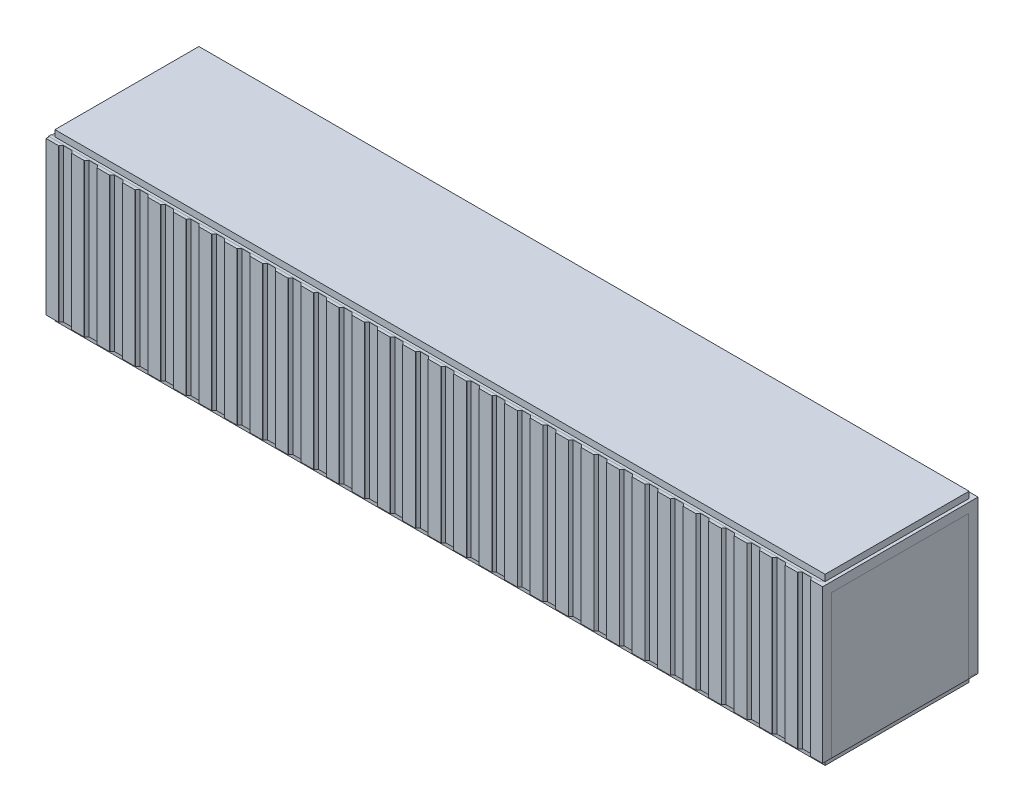
from build123d import *

# Parameters (mm, degrees)
EXTRUDE_THIN1_DEPTH      = 2400
BOSS_EXTRUDE1_DEPTH      = 10
SKETCH2_W                = 12090
SKETCH2_H                = 2260
BOSS_EXTRUDE2_DEPTH      = 100
SKETCH3_W                = 12090
SKETCH3_H                = 2340
BOSS_EXTRUDE3_DEPTH      = 10
SKETCH4_W                = 12090
SKETCH4_H                = 2260
BOSS_EXTRUDE4_DEPTH      = 100
CUT_EXTRUDE1_DEPTH       = 500
CUT_EXTRUDE1_DEPTH_BACK  = 50000
SKETCH5_W                = 2150
SKETCH5_H                = 2250
SKETCH6_W                = 2150
SKETCH6_H                = 2250
BOSS_EXTRUDE5_DEPTH      = 30
SKETCH7_W                = 2150
SKETCH7_H                = 2250
BOSS_EXTRUDE6_DEPTH      = 30
SKETCH8_W                = 12190
SKETCH8_H                = 2347.971493335
BOSS_EXTRUDE7_DEPTH      = 20
BOSS_EXTRUDE8_DEPTH      = 5
BOSS_EXTRUDE8_DEPTH_BACK = 40
SKETCH9_W                = 12160
SKETCH9_H                = 2300
BOSS_EXTRUDE9_DEPTH      = 5
BOSS_EXTRUDE9_DEPTH_BACK = 40
SKETCH10_W               = 12170
SKETCH10_H               = 2390


# Read off the part's stored shape, not the designer's step: Extrude-Thin1
with BuildPart() as part:
    # Extrude-Thin1 outline → Extrude-Thin1 (new body)
    with BuildSketch(Plane(origin=(0, 0, 0), x_dir=(1, 0, 0), z_dir=(0, 1, 0))):
        Polygon((0, 2440), (0, 0), (200, 0), (200, 5), (235, 40), (365, 40), (400, 5), (400, 0), (600, 0), (600, 5), (635, 40), (765, 40), (800, 5), (800, 0), (1000, 0), (1000, 5), (1035, 40), (1165, 40), (1200, 5), (1200, 0), (1400, 0), (1400, 5), (1435, 40), (1565, 40), (1600, 5), (1600, 0), (1800, 0), (1800, 5), (1835, 40), (1965, 40), (2000, 5), (2000, 0), (2200, 0), (2200, 5), (2235, 40), (2365, 40), (2400, 5), (2400, 0), (2600, 0), (2600, 5), (2635, 40), (2765, 40), (2800, 5), (2800, 0), (3000, 0), (3000, 5), (3035, 40), (3165, 40), (3200, 5), (3200, 0), (3400, 0), (3400, 5), (3435, 40), (3565, 40), (3600, 5), (3600, 0), (3800, 0), (3800, 5), (3835, 40), (3965, 40), (4000, 5), (4000, 0), (4200, 0), (4200, 5), (4235, 40), (4365, 40), (4400, 5), (4400, 0), (4600, 0), (4600, 5), (4635, 40), (4765, 40), (4800, 5), (4800, 0), (5000, 0), (5000, 5), (5035, 40), (5165, 40), (5200, 5), (5200, 0), (5400, 0), (5400, 5), (5435, 40), (5565, 40), (5600, 5), (5600, 0), (5800, 0), (5800, 5), (5835, 40), (5965, 40), (6000, 5), (6000, 0), (6200, 0), (6200, 5), (6235, 40), (6365, 40), (6400, 5), (6400, 0), (6600, 0), (6600, 5), (6635, 40), (6765, 40), (6800, 5), (6800, 0), (7000, 0), (7000, 5), (7035, 40), (7165, 40), (7200, 5), (7200, 0), (7400, 0), (7400, 5), (7435, 40), (7565, 40), (7600, 5), (7600, 0), (7800, 0), (7800, 5), (7835, 40), (7965, 40), (8000, 5), (8000, 0), (8200, 0), (8200, 5), (8235, 40), (8365, 40), (8400, 5), (8400, 0), (8600, 0), (8600, 5), (8635, 40), (8765, 40), (8800, 5), (8800, 0), (9000, 0), (9000, 5), (9035, 40), (9165, 40), (9200, 5), (9200, 0), (9400, 0), (9400, 5), (9435, 40), (9565, 40), (9600, 5), (9600, 0), (9800, 0), (9800, 5), (9835, 40), (9965, 40), (10000, 5), (10000, 0), (10200, 0), (10200, 5), (10235, 40), (10365, 40), (10400, 5), (10400, 0), (10600, 0), (10600, 5), (10635, 40), (10765, 40), (10800, 5), (10800, 0), (11000, 0), (11000, 5), (11035, 40), (11165, 40), (11200, 5), (11200, 0), (11400, 0), (11400, 5), (11435, 40), (11565, 40), (11600, 5), (11600, 0), (11800, 0), (11800, 5), (11835, 40), (11965, 40), (12000, 5), (12000, 0), (12190, 0), (12190, 2440), (12000, 2440), (12000, 2435), (11965, 2400), (11835, 2400), (11800, 2435), (11800, 2440), (11600, 2440), (11600, 2435), (11565, 2400), (11435, 2400), (11400, 2435), (11400, 2440), (11200, 2440), (11200, 2435), (11165, 2400), (11035, 2400), (11000, 2435), (11000, 2440), (10800, 2440), (10800, 2435), (10765, 2400), (10635, 2400), (10600, 2435), (10600, 2440), (10400, 2440), (10400, 2435), (10365, 2400), (10235, 2400), (10200, 2435), (10200, 2440), (10000, 2440), (10000, 2435), (9965, 2400), (9835, 2400), (9800, 2435), (9800, 2440), (9600, 2440), (9600, 2435), (9565, 2400), (9435, 2400), (9400, 2435), (9400, 2440), (9200, 2440), (9200, 2435), (9165, 2400), (9035, 2400), (9000, 2435), (9000, 2440), (8800, 2440), (8800, 2435), (8765, 2400), (8635, 2400), (8600, 2435), (8600, 2440), (8400, 2440), (8400, 2435), (8365, 2400), (8235, 2400), (8200, 2435), (8200, 2440), (8000, 2440), (8000, 2435), (7965, 2400), (7835, 2400), (7800, 2435), (7800, 2440), (7600, 2440), (7600, 2435), (7565, 2400), (7435, 2400), (7400, 2435), (7400, 2440), (7200, 2440), (7200, 2435), (7165, 2400), (7035, 2400), (7000, 2435), (7000, 2440), (6800, 2440), (6800, 2435), (6765, 2400), (6635, 2400), (6600, 2435), (6600, 2440), (6400, 2440), (6400, 2435), (6365, 2400), (6235, 2400), (6200, 2435), (6200, 2440), (6000, 2440), (6000, 2435), (5965, 2400), (5835, 2400), (5800, 2435), (5800, 2440), (5600, 2440), (5600, 2435), (5565, 2400), (5435, 2400), (5400, 2435), (5400, 2440), (5200, 2440), (5200, 2435), (5165, 2400), (5035, 2400), (5000, 2435), (5000, 2440), (4800, 2440), (4800, 2435), (4765, 2400), (4635, 2400), (4600, 2435), (4600, 2440), (4400, 2440), (4400, 2435), (4365, 2400), (4235, 2400), (4200, 2435), (4200, 2440), (4000, 2440), (4000, 2435), (3965, 2400), (3835, 2400), (3800, 2435), (3800, 2440), (3600, 2440), (3600, 2435), (3565, 2400), (3435, 2400), (3400, 2435), (3400, 2440), (3200, 2440), (3200, 2435), (3165, 2400), (3035, 2400), (3000, 2435), (3000, 2440), (2800, 2440), (2800, 2435), (2765, 2400), (2635, 2400), (2600, 2435), (2600, 2440), (2400, 2440), (2400, 2435), (2365, 2400), (2235, 2400), (2200, 2435), (2200, 2440), (2000, 2440), (2000, 2435), (1965, 2400), (1835, 2400), (1800, 2435), (1800, 2440), (1600, 2440), (1600, 2435), (1565, 2400), (1435, 2400), (1400, 2435), (1400, 2440), (1200, 2440), (1200, 2435), (1165, 2400), (1035, 2400), (1000, 2435), (1000, 2440), (800, 2440), (800, 2435), (765, 2400), (635, 2400), (600, 2435), (600, 2440), (400, 2440), (400, 2435), (365, 2400), (235, 2400), (200, 2435), (200, 2440), align=None)
        Polygon((174.289321881, 50), (50, 50), (50, 2390), (174.289321881, 2390), (214.289321881, 2350), (385.710678119, 2350), (425.710678119, 2390), (574.289321881, 2390), (614.289321881, 2350), (785.710678119, 2350), (825.710678119, 2390), (974.289321881, 2390), (1014.289321881, 2350), (1185.710678119, 2350), (1225.710678119, 2390), (1374.289321881, 2390), (1414.289321881, 2350), (1585.710678119, 2350), (1625.710678119, 2390), (1774.289321881, 2390), (1814.289321881, 2350), (1985.710678119, 2350), (2025.710678119, 2390), (2174.289321881, 2390), (2214.289321881, 2350), (2385.710678119, 2350), (2425.710678119, 2390), (2574.289321881, 2390), (2614.289321881, 2350), (2785.710678119, 2350), (2825.710678119, 2390), (2974.289321881, 2390), (3014.289321881, 2350), (3185.710678119, 2350), (3225.710678119, 2390), (3374.289321881, 2390), (3414.289321881, 2350), (3585.710678119, 2350), (3625.710678119, 2390), (3774.289321881, 2390), (3814.289321881, 2350), (3985.710678119, 2350), (4025.710678119, 2390), (4174.289321881, 2390), (4214.289321881, 2350), (4385.710678119, 2350), (4425.710678119, 2390), (4574.289321881, 2390), (4614.289321881, 2350), (4785.710678119, 2350), (4825.710678119, 2390), (4974.289321881, 2390), (5014.289321881, 2350), (5185.710678119, 2350), (5225.710678119, 2390), (5374.289321881, 2390), (5414.289321881, 2350), (5585.710678119, 2350), (5625.710678119, 2390), (5774.289321881, 2390), (5814.289321881, 2350), (5985.710678119, 2350), (6025.710678119, 2390), (6174.289321881, 2390), (6214.289321881, 2350), (6385.710678119, 2350), (6425.710678119, 2390), (6574.289321881, 2390), (6614.289321881, 2350), (6785.710678119, 2350), (6825.710678119, 2390), (6974.289321881, 2390), (7014.289321881, 2350), (7185.710678119, 2350), (7225.710678119, 2390), (7374.289321881, 2390), (7414.289321881, 2350), (7585.710678119, 2350), (7625.710678119, 2390), (7774.289321881, 2390), (7814.289321881, 2350), (7985.710678119, 2350), (8025.710678119, 2390), (8174.289321881, 2390), (8214.289321881, 2350), (8385.710678119, 2350), (8425.710678119, 2390), (8574.289321881, 2390), (8614.289321881, 2350), (8785.710678119, 2350), (8825.710678119, 2390), (8974.289321881, 2390), (9014.289321881, 2350), (9185.710678119, 2350), (9225.710678119, 2390), (9374.289321881, 2390), (9414.289321881, 2350), (9585.710678119, 2350), (9625.710678119, 2390), (9774.289321881, 2390), (9814.289321881, 2350), (9985.710678119, 2350), (10025.710678119, 2390), (10174.289321881, 2390), (10214.289321881, 2350), (10385.710678119, 2350), (10425.710678119, 2390), (10574.289321881, 2390), (10614.289321881, 2350), (10785.710678119, 2350), (10825.710678119, 2390), (10974.289321881, 2390), (11014.289321881, 2350), (11185.710678119, 2350), (11225.710678119, 2390), (11374.289321881, 2390), (11414.289321881, 2350), (11585.710678119, 2350), (11625.710678119, 2390), (11774.289321881, 2390), (11814.289321881, 2350), (11985.710678119, 2350), (12025.710678119, 2390), (12140, 2390), (12140, 50), (12025.710678119, 50), (11985.710678119, 90), (11814.289321881, 90), (11774.289321881, 50), (11625.710678119, 50), (11585.710678119, 90), (11414.289321881, 90), (11374.289321881, 50), (11225.710678119, 50), (11185.710678119, 90), (11014.289321881, 90), (10974.289321881, 50), (10825.710678119, 50), (10785.710678119, 90), (10614.289321881, 90), (10574.289321881, 50), (10425.710678119, 50), (10385.710678119, 90), (10214.289321881, 90), (10174.289321881, 50), (10025.710678119, 50), (9985.710678119, 90), (9814.289321881, 90), (9774.289321881, 50), (9625.710678119, 50), (9585.710678119, 90), (9414.289321881, 90), (9374.289321881, 50), (9225.710678119, 50), (9185.710678119, 90), (9014.289321881, 90), (8974.289321881, 50), (8825.710678119, 50), (8785.710678119, 90), (8614.289321881, 90), (8574.289321881, 50), (8425.710678119, 50), (8385.710678119, 90), (8214.289321881, 90), (8174.289321881, 50), (8025.710678119, 50), (7985.710678119, 90), (7814.289321881, 90), (7774.289321881, 50), (7625.710678119, 50), (7585.710678119, 90), (7414.289321881, 90), (7374.289321881, 50), (7225.710678119, 50), (7185.710678119, 90), (7014.289321881, 90), (6974.289321881, 50), (6825.710678119, 50), (6785.710678119, 90), (6614.289321881, 90), (6574.289321881, 50), (6425.710678119, 50), (6385.710678119, 90), (6214.289321881, 90), (6174.289321881, 50), (6025.710678119, 50), (5985.710678119, 90), (5814.289321881, 90), (5774.289321881, 50), (5625.710678119, 50), (5585.710678119, 90), (5414.289321881, 90), (5374.289321881, 50), (5225.710678119, 50), (5185.710678119, 90), (5014.289321881, 90), (4974.289321881, 50), (4825.710678119, 50), (4785.710678119, 90), (4614.289321881, 90), (4574.289321881, 50), (4425.710678119, 50), (4385.710678119, 90), (4214.289321881, 90), (4174.289321881, 50), (4025.710678119, 50), (3985.710678119, 90), (3814.289321881, 90), (3774.289321881, 50), (3625.710678119, 50), (3585.710678119, 90), (3414.289321881, 90), (3374.289321881, 50), (3225.710678119, 50), (3185.710678119, 90), (3014.289321881, 90), (2974.289321881, 50), (2825.710678119, 50), (2785.710678119, 90), (2614.289321881, 90), (2574.289321881, 50), (2425.710678119, 50), (2385.710678119, 90), (2214.289321881, 90), (2174.289321881, 50), (2025.710678119, 50), (1985.710678119, 90), (1814.289321881, 90), (1774.289321881, 50), (1625.710678119, 50), (1585.710678119, 90), (1414.289321881, 90), (1374.289321881, 50), (1225.710678119, 50), (1185.710678119, 90), (1014.289321881, 90), (974.289321881, 50), (825.710678119, 50), (785.710678119, 90), (614.289321881, 90), (574.289321881, 50), (425.710678119, 50), (385.710678119, 90), (214.289321881, 90), align=None, mode=Mode.SUBTRACT)
    extrude(amount=EXTRUDE_THIN1_DEPTH)

    # Sketch1<2> → Boss-Extrude1 (add)
    with BuildSketch(Plane(origin=(0, 0, 0), x_dir=(1, 0, 0), z_dir=(0, 1, 0))):
        Polygon((0, 0), (200, 0), (200, 5), (235, 40), (365, 40), (400, 5), (400, 0), (600, 0), (600, 5), (635, 40), (765, 40), (800, 5), (800, 0), (1000, 0), (1000, 5), (1035, 40), (1165, 40), (1200, 5), (1200, 0), (1400, 0), (1400, 5), (1435, 40), (1565, 40), (1600, 5), (1600, 0), (1800, 0), (1800, 5), (1835, 40), (1965, 40), (2000, 5), (2000, 0), (2200, 0), (2200, 5), (2235, 40), (2365, 40), (2400, 5), (2400, 0), (2600, 0), (2600, 5), (2635, 40), (2765, 40), (2800, 5), (2800, 0), (3000, 0), (3000, 5), (3035, 40), (3165, 40), (3200, 5), (3200, 0), (3400, 0), (3400, 5), (3435, 40), (3565, 40), (3600, 5), (3600, 0), (3800, 0), (3800, 5), (3835, 40), (3965, 40), (4000, 5), (4000, 0), (4200, 0), (4200, 5), (4235, 40), (4365, 40), (4400, 5), (4400, 0), (4600, 0), (4600, 5), (4635, 40), (4765, 40), (4800, 5), (4800, 0), (5000, 0), (5000, 5), (5035, 40), (5165, 40), (5200, 5), (5200, 0), (5400, 0), (5400, 5), (5435, 40), (5565, 40), (5600, 5), (5600, 0), (5800, 0), (5800, 5), (5835, 40), (5965, 40), (6000, 5), (6000, 0), (6200, 0), (6200, 5), (6235, 40), (6365, 40), (6400, 5), (6400, 0), (6600, 0), (6600, 5), (6635, 40), (6765, 40), (6800, 5), (6800, 0), (7000, 0), (7000, 5), (7035, 40), (7165, 40), (7200, 5), (7200, 0), (7400, 0), (7400, 5), (7435, 40), (7565, 40), (7600, 5), (7600, 0), (7800, 0), (7800, 5), (7835, 40), (7965, 40), (8000, 5), (8000, 0), (8200, 0), (8200, 5), (8235, 40), (8365, 40), (8400, 5), (8400, 0), (8600, 0), (8600, 5), (8635, 40), (8765, 40), (8800, 5), (8800, 0), (9000, 0), (9000, 5), (9035, 40), (9165, 40), (9200, 5), (9200, 0), (9400, 0), (9400, 5), (9435, 40), (9565, 40), (9600, 5), (9600, 0), (9800, 0), (9800, 5), (9835, 40), (9965, 40), (10000, 5), (10000, 0), (10200, 0), (10200, 5), (10235, 40), (10365, 40), (10400, 5), (10400, 0), (10600, 0), (10600, 5), (10635, 40), (10765, 40), (10800, 5), (10800, 0), (11000, 0), (11000, 5), (11035, 40), (11165, 40), (11200, 5), (11200, 0), (11400, 0), (11400, 5), (11435, 40), (11565, 40), (11600, 5), (11600, 0), (11800, 0), (11800, 5), (11835, 40), (11965, 40), (12000, 5), (12000, 0), (12190, 0), (12190, 2440), (12000, 2440), (12000, 2435), (11965, 2400), (11835, 2400), (11800, 2435), (11800, 2440), (11600, 2440), (11600, 2435), (11565, 2400), (11435, 2400), (11400, 2435), (11400, 2440), (11200, 2440), (11200, 2435), (11165, 2400), (11035, 2400), (11000, 2435), (11000, 2440), (10800, 2440), (10800, 2435), (10765, 2400), (10635, 2400), (10600, 2435), (10600, 2440), (10400, 2440), (10400, 2435), (10365, 2400), (10235, 2400), (10200, 2435), (10200, 2440), (10000, 2440), (10000, 2435), (9965, 2400), (9835, 2400), (9800, 2435), (9800, 2440), (9600, 2440), (9600, 2435), (9565, 2400), (9435, 2400), (9400, 2435), (9400, 2440), (9200, 2440), (9200, 2435), (9165, 2400), (9035, 2400), (9000, 2435), (9000, 2440), (8800, 2440), (8800, 2435), (8765, 2400), (8635, 2400), (8600, 2435), (8600, 2440), (8400, 2440), (8400, 2435), (8365, 2400), (8235, 2400), (8200, 2435), (8200, 2440), (8000, 2440), (8000, 2435), (7965, 2400), (7835, 2400), (7800, 2435), (7800, 2440), (7600, 2440), (7600, 2435), (7565, 2400), (7435, 2400), (7400, 2435), (7400, 2440), (7200, 2440), (7200, 2435), (7165, 2400), (7035, 2400), (7000, 2435), (7000, 2440), (6800, 2440), (6800, 2435), (6765, 2400), (6635, 2400), (6600, 2435), (6600, 2440), (6400, 2440), (6400, 2435), (6365, 2400), (6235, 2400), (6200, 2435), (6200, 2440), (6000, 2440), (6000, 2435), (5965, 2400), (5835, 2400), (5800, 2435), (5800, 2440), (5600, 2440), (5600, 2435), (5565, 2400), (5435, 2400), (5400, 2435), (5400, 2440), (5200, 2440), (5200, 2435), (5165, 2400), (5035, 2400), (5000, 2435), (5000, 2440), (4800, 2440), (4800, 2435), (4765, 2400), (4635, 2400), (4600, 2435), (4600, 2440), (4400, 2440), (4400, 2435), (4365, 2400), (4235, 2400), (4200, 2435), (4200, 2440), (4000, 2440), (4000, 2435), (3965, 2400), (3835, 2400), (3800, 2435), (3800, 2440), (3600, 2440), (3600, 2435), (3565, 2400), (3435, 2400), (3400, 2435), (3400, 2440), (3200, 2440), (3200, 2435), (3165, 2400), (3035, 2400), (3000, 2435), (3000, 2440), (2800, 2440), (2800, 2435), (2765, 2400), (2635, 2400), (2600, 2435), (2600, 2440), (2400, 2440), (2400, 2435), (2365, 2400), (2235, 2400), (2200, 2435), (2200, 2440), (2000, 2440), (2000, 2435), (1965, 2400), (1835, 2400), (1800, 2435), (1800, 2440), (1600, 2440), (1600, 2435), (1565, 2400), (1435, 2400), (1400, 2435), (1400, 2440), (1200, 2440), (1200, 2435), (1165, 2400), (1035, 2400), (1000, 2435), (1000, 2440), (800, 2440), (800, 2435), (765, 2400), (635, 2400), (600, 2435), (600, 2440), (400, 2440), (400, 2435), (365, 2400), (235, 2400), (200, 2435), (200, 2440), (0, 2440), align=None)
    extrude(amount=BOSS_EXTRUDE1_DEPTH)

    # Sketch2 → Boss-Extrude2 (add)
    with BuildSketch(Plane(origin=(0, 0, 0), x_dir=(1, 0, 0), z_dir=(0, 1, 0))):
        with Locations((6095, 1220)):
            Rectangle(SKETCH2_W, SKETCH2_H)
    extrude(amount=-BOSS_EXTRUDE2_DEPTH)

    # Sketch3 → Boss-Extrude3 (add)
    with BuildSketch(Plane(origin=(0, 2400, 0), x_dir=(1, 0, 0), z_dir=(0, 1, 0))):
        with Locations((6095, 1220)):
            Rectangle(SKETCH3_W, SKETCH3_H)
    extrude(amount=-BOSS_EXTRUDE3_DEPTH)

    # Sketch4 → Boss-Extrude4 (add)
    with BuildSketch(Plane(origin=(0, 2400, 0), x_dir=(1, 0, 0), z_dir=(0, 1, 0))):
        with Locations((6095, 1220)):
            Rectangle(SKETCH4_W, SKETCH4_H)
    extrude(amount=BOSS_EXTRUDE4_DEPTH)

    # Sketch5 → Cut-Extrude1 (cut, two sides: drawn at the far end of the back side and taken through both)
    with BuildSketch(Plane(origin=(12190, 0, 0), x_dir=(0, 0, -1), z_dir=(1, 0, 0)).offset(-CUT_EXTRUDE1_DEPTH_BACK)):
        with Locations((1215, 1125)):
            Rectangle(SKETCH5_W, SKETCH5_H)
    extrude(amount=CUT_EXTRUDE1_DEPTH + CUT_EXTRUDE1_DEPTH_BACK, mode=Mode.SUBTRACT)


with BuildPart() as body_2:
    # Sketch6 → Boss-Extrude5 (new body)
    with BuildSketch(Plane(origin=(12190, 0, 0), x_dir=(0, 0, -1), z_dir=(1, 0, 0))):
        with Locations((1215, 1125)):
            Rectangle(SKETCH6_W, SKETCH6_H)
    extrude(amount=-BOSS_EXTRUDE5_DEPTH)


with BuildPart() as body_3:
    # Sketch7 → Boss-Extrude6 (new body)
    with BuildSketch(Plane.ZY.offset(10)):
        with Locations((-1215, 1125)):
            Rectangle(SKETCH7_W, SKETCH7_H)
    extrude(amount=-BOSS_EXTRUDE6_DEPTH)


with BuildPart() as body_4:
    # Sketch8 → Boss-Extrude7 (new body)
    with BuildSketch(Plane(origin=(0, 0, 0), x_dir=(1, 0, 0), z_dir=(0, 1, 0))):
        with Locations((6095, 1223.985746668)):
            Rectangle(SKETCH8_W, SKETCH8_H)
    extrude(amount=BOSS_EXTRUDE7_DEPTH)


with BuildPart() as body_5:
    # Sketch9 → Boss-Extrude8 (new, two sides: drawn at the far end of the back side and taken through both)
    with BuildSketch(Plane.XY.offset(-2350).offset(-BOSS_EXTRUDE8_DEPTH_BACK)):
        with Locations((6080, 1160)):
            Rectangle(SKETCH9_W, SKETCH9_H)
    extrude(amount=BOSS_EXTRUDE8_DEPTH + BOSS_EXTRUDE8_DEPTH_BACK)


with BuildPart() as body_6:
    # Sketch10 → Boss-Extrude9 (new, two sides: drawn at the far end of the back side and taken through both)
    with BuildSketch(Plane(origin=(0, 0, -90), x_dir=(-1, 0, 0), z_dir=(0, 0, -1)).offset(-BOSS_EXTRUDE9_DEPTH_BACK)):
        with Locations((-6075, 1205)):
            Rectangle(SKETCH10_W, SKETCH10_H)
    extrude(amount=BOSS_EXTRUDE9_DEPTH + BOSS_EXTRUDE9_DEPTH_BACK)


solid = Compound([part.part, body_2.part, body_3.part, body_4.part, body_5.part, body_6.part])
